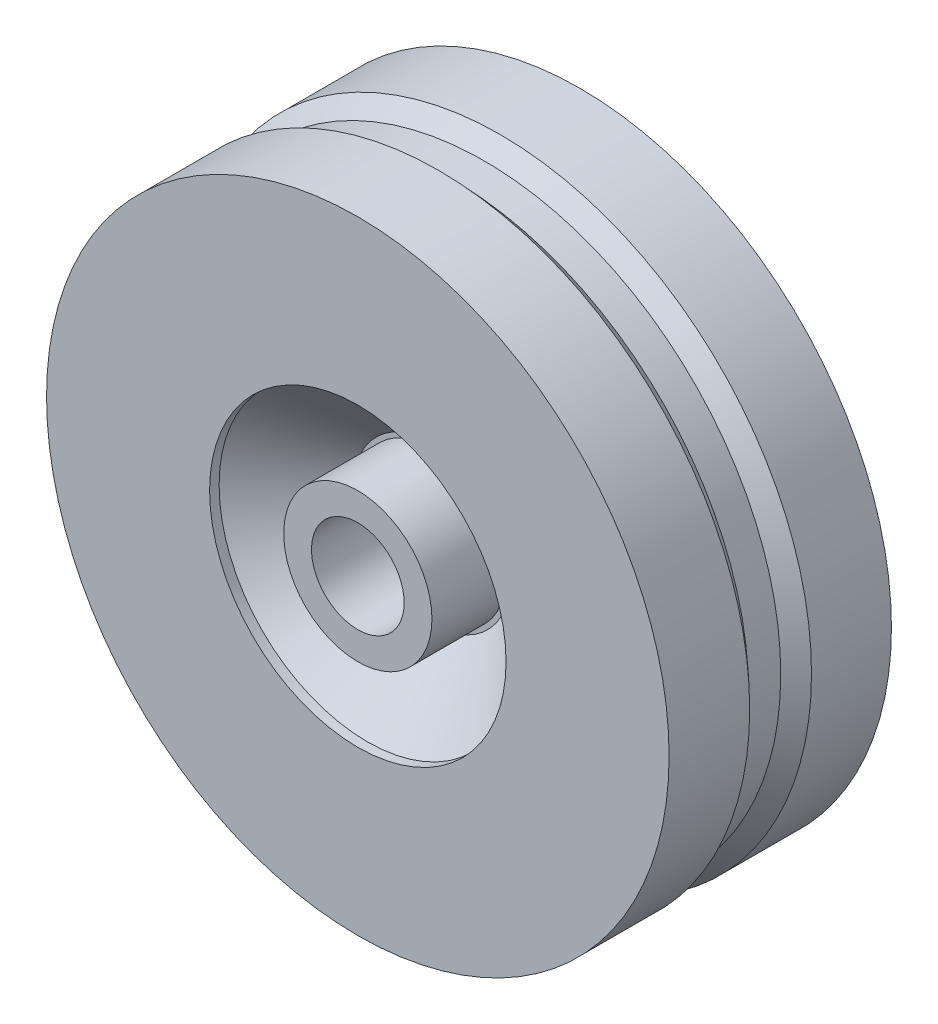
from build123d import *

# Parameters (mm, degrees)
SKETCH1_R           = 20
SKETCH1_R_2         = 3.125
BOSS_EXTRUDE1_DEPTH = 15
SKETCH2_R           = 16.5
SKETCH2_R_2         = 5
CUT_EXTRUDE1_DEPTH  = 5


# Read off the part's stored shape, not the designer's step: Revolve-Thin19
with BuildPart() as part:
    # Sketch1 → Boss-Extrude1 (new body)
    with BuildSketch(Plane.XY):
        Circle(SKETCH1_R)
        Circle(SKETCH1_R_2, mode=Mode.SUBTRACT)
    extrude(amount=BOSS_EXTRUDE1_DEPTH)

    # Sketch2 → Cut-Extrude1 (cut)
    with BuildSketch(Plane.XY.offset(15)):
        Circle(SKETCH2_R)
        Circle(SKETCH2_R_2, mode=Mode.SUBTRACT)
    cut_extrude1 = extrude(amount=-CUT_EXTRUDE1_DEPTH, mode=Mode.SUBTRACT)

    # Mirror1: Cut-Extrude1 across plane
    add(cut_extrude1.mirror(Plane.XY.offset(7.5)), mode=Mode.SUBTRACT)

    # Revolve-Thin19 outline → Revolve-Thin19 (revolve)
    with BuildSketch(Plane.XZ):
        Polygon((10, 1.070581714), (10, 0), (16.5, 0), (16.5, 5), (6.348063393, 5), align=None)
        Polygon((20, 0), (21, 0), (21, 5.392941829), (20, 6.468923892), align=None)
        Polygon((20, 8.634806339), (21, 9.564189861), (21, 15), (20, 15), align=None)
        Polygon((16.5, 10), (16.5, 15), (10, 15), (10, 14.358101386), (5.310761078, 10), align=None)
    revolve(axis=Axis((0, 0, 0), (0, 0, 1)))


solid = part.part
